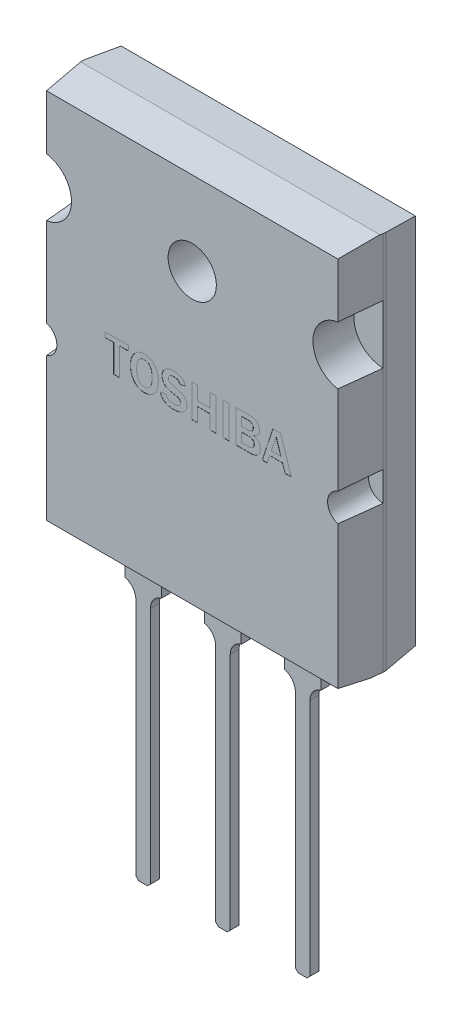
from build123d import *
from OCP.BRepFilletAPI import BRepFilletAPI_MakeChamfer

# Parameters (mm, degrees)
SZKIC1_W                              = 20.5
SZKIC1_H                              = 26
SZKIC1_R                              = 1.65
DODANIE_WYCI_GNI_CIE1_DEPTH           = 5.2
SZKIC2_R                              = 2
SZKIC2_R_2                            = 1
WYTNIJ_WYCI_GNI_CIE1_DEPTH            = 2.8
SZKIC4_W                              = 2.5
SZKIC4_H                              = 0.6
DODANIE_WYCI_GNI_CIE2_DEPTH           = 2.5
SZKIC7_W                              = 1
SZKIC7_H                              = 0.6
DODANIE_WYCI_GNI_CIE3_DEPTH           = 17.5
ZAOKR_GLENIE2_R                       = 1
SFAZOWANIE1_SIZE                      = 0.2
SZYK_LINIOWY2_COUNT                   = 2
SZYK_LINIOWY2_PITCH                   = 5.45
ZAOKR_GLENIE2_OF_SZYK_LINIOWY2_R      = 1
SFAZOWANIE1_OF_SZYK_LINIOWY2_SIZE     = 0.2
SZYK_LINIOWY2_COL_COUNT               = 2
SZYK_LINIOWY2_COL_PITCH               = 5.45
ZAOKR_GLENIE2_OF_SZYK_LINIOWY2_COL_R  = 1
SFAZOWANIE1_OF_SZYK_LINIOWY2_COL_SIZE = 0.2
SFAZOWANIE3_SIZE                      = 2.2
SFAZOWANIE3_SIZE2                     = 0.19247506
SFAZOWANIE4_SIZE                      = 2.8
SFAZOWANIE4_SIZE2                     = 0.294291859
SFAZOWANIE5_SIZE                      = 0.294291859
SFAZOWANIE5_SIZE_2                    = 2.8
SFAZOWANIE6_SIZE                      = 2.2
SFAZOWANIE6_SIZE2                     = 0.270126034
SFAZOWANIE7_SIZE                      = 2
SFAZOWANIE7_SIZE2                     = 0.281081669
SZKIC8_W                              = 0.401396687
SZKIC8_H                              = 2.223120117
WYTNIJ_WYCI_GNI_CIE2_DEPTH            = 0.01


with BuildPart() as part:
    # Szkic1 → Dodanie-wyciągnięcie1 (new body)
    with BuildSketch(Plane.XY):
        with Locations((-13.182644045, 6.74550931)):
            Rectangle(SZKIC1_W, SZKIC1_H)
        with Locations((-13.182644045, 13.74550931)):
            Circle(SZKIC1_R, mode=Mode.SUBTRACT)
    extrude(amount=DODANIE_WYCI_GNI_CIE1_DEPTH)

    # Szkic2 → Wytnij-wyciągnięcie1 (cut)
    with BuildSketch(Plane.XY.offset(5.2)):
        with Locations((-23.432644045, 13.74550931)):
            Circle(SZKIC2_R)
        with Locations((-2.932644045, 13.74550931)):
            Circle(SZKIC2_R)
        with Locations((-23.432644045, 4.74550931)):
            Circle(SZKIC2_R_2)
        with Locations((-2.932644045, 4.74550931)):
            Circle(SZKIC2_R_2)
    extrude(amount=-WYTNIJ_WYCI_GNI_CIE1_DEPTH, mode=Mode.SUBTRACT)

    # Szkic4 → Dodanie-wyciągnięcie2 (add)
    with BuildSketch(Plane.XZ.offset(6.25449069)):
        with Locations((-13.183317029, 2.8)):
            Rectangle(SZKIC4_W, SZKIC4_H)
    dodanie_wyci_gni_cie2 = extrude(amount=DODANIE_WYCI_GNI_CIE2_DEPTH)

    # Szkic7 → Dodanie-wyciągnięcie3 (add)
    with BuildSketch(Plane.XZ.offset(8.75449069)):
        with Locations((-13.183317029, 2.8)):
            Rectangle(SZKIC7_W, SZKIC7_H)
    dodanie_wyci_gni_cie3 = extrude(amount=DODANIE_WYCI_GNI_CIE3_DEPTH)

    # Zaokrąglenie2
    # the kernel refuses this fillet: 1 mm, written as the material it adds along each edge
    with BuildSketch(Plane(origin=(-13.683317029, -8.75449069, 2.5), x_dir=(-1, 0, 0), z_dir=(0, 0, 1)), Plane(origin=(-12.683317029, -8.75449069, 3.1), x_dir=(1, 0, 0), z_dir=(0, 0, -1))) as zaokr_glenie2_piece_1:
        with BuildLine():
            CenterArc((1, 0.968245837), ZAOKR_GLENIE2_R, 180, 75.522487814)
            Line((0, 0.968245837), (-0.02, 0.968245837))
            Line((-0.02, 0.968245837), (-0.02, 0))
            Line((-0.02, 0), (0, -0.02))
            ThreePointArc((0, -0.02), (0.375, -0.02), (0.745, -0.019364917))
            Line((0.745, -0.019364917), (0.75, 0))
        make_face()
    extrude(amount=0.6)

    # Sfazowanie1
    sfazowanie1_edges = [part.edges().sort_by_distance(p)[0] for p in [
        (-12.683317029, -26.25449069, 2.8),
        (-13.683317029, -26.25449069, 2.8),
    ]]
    chamfer(sfazowanie1_edges, length=SFAZOWANIE1_SIZE)

    # Szyk liniowy2: Dodanie-wyciągnięcie2, Dodanie-wyciągnięcie3 ×2
    with Locations(*[(-i * SZYK_LINIOWY2_PITCH, 0, 0) for i in range(1, SZYK_LINIOWY2_COUNT)]):
        add(dodanie_wyci_gni_cie2)
        add(dodanie_wyci_gni_cie3)

    # Zaokrąglenie2 of Szyk liniowy2
    # the kernel refuses this fillet: 1 mm, written as the material it adds along each edge
    with BuildSketch(Plane(origin=(-19.133317029, -8.75449069, 2.5), x_dir=(-1, 0, 0), z_dir=(0, 0, 1)), Plane(origin=(-18.133317029, -8.75449069, 3.1), x_dir=(1, 0, 0), z_dir=(0, 0, -1))) as zaokr_glenie2_of_szyk_liniowy2_piece_1:
        with BuildLine():
            CenterArc((1, 0.968245837), ZAOKR_GLENIE2_OF_SZYK_LINIOWY2_R, 180, 75.522487814)
            Line((0, 0.968245837), (-0.02, 0.968245837))
            Line((-0.02, 0.968245837), (-0.02, 0))
            Line((-0.02, 0), (0, -0.02))
            ThreePointArc((0, -0.02), (0.375, -0.02), (0.745, -0.019364917))
            Line((0.745, -0.019364917), (0.75, 0))
        make_face()
    extrude(amount=0.6)

    # Sfazowanie1 of Szyk liniowy2
    sfazowanie1_of_szyk_liniowy2_edges = [part.edges().sort_by_distance(p)[0] for p in [
        (-18.133317029, -26.25449069, 2.8),
        (-19.133317029, -26.25449069, 2.8),
    ]]
    chamfer(sfazowanie1_of_szyk_liniowy2_edges, length=SFAZOWANIE1_OF_SZYK_LINIOWY2_SIZE)

    # Szyk liniowy2 col: Dodanie-wyciągnięcie2, Dodanie-wyciągnięcie3 ×2
    with Locations(*[(i * SZYK_LINIOWY2_COL_PITCH, 0, 0) for i in range(1, SZYK_LINIOWY2_COL_COUNT)]):
        add(dodanie_wyci_gni_cie2)
        add(dodanie_wyci_gni_cie3)

    # Zaokrąglenie2 of Szyk liniowy2 col
    # the kernel refuses this fillet: 1 mm, written as the material it adds along each edge
    with BuildSketch(Plane(origin=(-8.233317029, -8.75449069, 2.5), x_dir=(-1, 0, 0), z_dir=(0, 0, 1)), Plane(origin=(-7.233317029, -8.75449069, 3.1), x_dir=(1, 0, 0), z_dir=(0, 0, -1))) as zaokr_glenie2_of_szyk_liniowy2_col_piece_1:
        with BuildLine():
            CenterArc((1, 0.968245837), ZAOKR_GLENIE2_OF_SZYK_LINIOWY2_COL_R, 180, 75.522487814)
            Line((0, 0.968245837), (-0.02, 0.968245837))
            Line((-0.02, 0.968245837), (-0.02, 0))
            Line((-0.02, 0), (0, -0.02))
            ThreePointArc((0, -0.02), (0.375, -0.02), (0.745, -0.019364917))
            Line((0.745, -0.019364917), (0.75, 0))
        make_face()
    extrude(amount=0.6)

    # Sfazowanie1 of Szyk liniowy2 col
    sfazowanie1_of_szyk_liniowy2_col_edges = [part.edges().sort_by_distance(p)[0] for p in [
        (-7.233317029, -26.25449069, 2.8),
        (-8.233317029, -26.25449069, 2.8),
    ]]
    chamfer(sfazowanie1_of_szyk_liniowy2_col_edges, length=SFAZOWANIE1_OF_SZYK_LINIOWY2_COL_SIZE)

    # Sfazowanie3: one chamfer whose edges measure the first distance from different faces: ONE call of the kernel's chamfer builder (chamfer() names one face for all edges)
    sfazowanie3_edges_1 = [part.edges().sort_by_distance(p)[0] for p in [
        (-2.932644045, 6.74550931, 0),
    ]]
    sfazowanie3_side_1 = [part.faces().sort_by_distance(p)[0] for p in [
        (-2.932644045, 6.177941742, 2.42972973),
    ]]
    sfazowanie3_edges_2 = [part.edges().sort_by_distance(p)[0] for p in [
        (-23.432644045, 6.74550931, 0),
    ]]
    sfazowanie3_side_2 = [part.faces().sort_by_distance(p)[0] for p in [
        (-23.432644045, 6.177941742, 2.42972973),
    ]]
    sfazowanie3 = BRepFilletAPI_MakeChamfer(part.part.solid().wrapped)
    for e in sfazowanie3_edges_1:
        sfazowanie3.Add(SFAZOWANIE3_SIZE, SFAZOWANIE3_SIZE2, e.wrapped, sfazowanie3_side_1[0].wrapped)  # the first distance lies on this face
    for e in sfazowanie3_edges_2:
        sfazowanie3.Add(SFAZOWANIE3_SIZE, SFAZOWANIE3_SIZE2, e.wrapped, sfazowanie3_side_2[0].wrapped)  # the first distance lies on this face
    add(Compound.cast(sfazowanie3.Shape()), mode=Mode.REPLACE)

    # Sfazowanie4: one chamfer whose edges measure the first distance from different faces: ONE call of the kernel's chamfer builder (chamfer() names one face for all edges)
    sfazowanie4_edges_1 = [part.edges().sort_by_distance(p)[0] for p in [
        (-2.932644045, -1.25449069, 5.2),
        (-2.932644045, 8.74550931, 5.2),
        (-2.932644045, 17.74550931, 5.2),
    ]]
    sfazowanie4_side_1 = [part.faces().sort_by_distance(p)[0] for p in [
        (-2.932644045, -5.992765643, 3.7),
    ]]
    sfazowanie4_edges_2 = [part.edges().sort_by_distance(p)[0] for p in [
        (-23.432644045, 17.74550931, 5.2),
        (-23.432644045, -1.25449069, 5.2),
        (-23.432644045, 8.74550931, 5.2),
    ]]
    sfazowanie4_side_2 = [part.faces().sort_by_distance(p)[0] for p in [
        (-23.432644045, 19.483784263, 3.7),
    ]]
    sfazowanie4 = BRepFilletAPI_MakeChamfer(part.part.solid().wrapped)
    for e in sfazowanie4_edges_1:
        sfazowanie4.Add(SFAZOWANIE4_SIZE, SFAZOWANIE4_SIZE2, e.wrapped, sfazowanie4_side_1[0].wrapped)  # the first distance lies on this face
    for e in sfazowanie4_edges_2:
        sfazowanie4.Add(SFAZOWANIE4_SIZE, SFAZOWANIE4_SIZE2, e.wrapped, sfazowanie4_side_2[0].wrapped)  # the first distance lies on this face
    add(Compound.cast(sfazowanie4.Shape()), mode=Mode.REPLACE)

    # Sfazowanie5
    # the kernel refuses this chamfer: 2.8, 0.294291859 mm, written as the material it takes off along each edge
    with BuildSketch(Plane(origin=(-30.518693961, 19.74550931, 0), x_dir=(0, -0.9396808679591201, -0.3420524322258136), z_dir=(1, 0, 0))) as sfazowanie5_piece_1:
        Polygon((SFAZOWANIE5_SIZE * 0.939680867141, -SFAZOWANIE5_SIZE * 0.342052431928), (-SFAZOWANIE5_SIZE_2 * 0.342052432226, -SFAZOWANIE5_SIZE_2 * 0.939680867959), (0, 0), align=None)
    extrude(amount=34.672099833, mode=Mode.SUBTRACT)
    with BuildSketch(Plane(origin=(-30.416877162, 19.74550931, 5.2), x_dir=(0, -0.9396808679591199, 0.34205243222581383), z_dir=(1, 0, 0))) as sfazowanie5_piece_2:
        Polygon((SFAZOWANIE5_SIZE * 0.939680867141, SFAZOWANIE5_SIZE * 0.342052431928), (-SFAZOWANIE5_SIZE_2 * 0.342052432226, SFAZOWANIE5_SIZE_2 * 0.939680867959), (0, 0), align=None)
    extrude(amount=34.468466235, mode=Mode.SUBTRACT)

    # Sfazowanie6
    sfazowanie6_edges = [part.edges().sort_by_distance(p)[0] for p in [
        (-13.182644045, -6.25449069, 0),
    ]]
    sfazowanie6_side = [part.faces().sort_by_distance(p)[0] for p in [
        (-3.144136362, -6.25449069, 2.3),
    ]]
    chamfer(sfazowanie6_edges, length=SFAZOWANIE6_SIZE, length2=SFAZOWANIE6_SIZE2, reference=sfazowanie6_side[0])

    # Sfazowanie7
    sfazowanie7_edges = [part.edges().sort_by_distance(p)[0] for p in [
        (-13.182644045, -6.25449069, 5.2),
    ]]
    sfazowanie7_side = [part.faces().sort_by_distance(p)[0] for p in [
        (-13.182590135, -6.25449069, 3.763782719),
    ]]
    chamfer(sfazowanie7_edges, length=SFAZOWANIE7_SIZE, length2=SFAZOWANIE7_SIZE2, reference=sfazowanie7_side[0])

    # Szkic8 → Wytnij-wyciągnięcie2 (cut)
    # profile 1 of 7: a face of its own
    with BuildSketch(Plane.XY.offset(5.2)):
        Polygon((-18.150298801, 4.960266993), (-18.551695489, 4.960266993), (-18.551695489, 6.843743759), (-19.138352186, 6.843743759), (-19.138352186, 7.18338711), (-17.532765435, 7.18338711), (-17.532765435, 6.843743759), (-18.150298801, 6.843743759), align=None)
    # profile 2 of 7: a face of its own
    with BuildSketch(Plane.XY.offset(5.2)):
        with BuildLine():
            add(Edge.make_bspline(
                [(-16.461248555, 4.929390325), (-16.497654026, 4.930381614), (-16.568714872, 4.93231654), (-16.672040727, 4.948211154), (-16.769490735, 4.973259087), (-16.860140354, 5.010706157), (-16.945407926, 5.056745376), (-17.023530318, 5.114663478), (-17.096018206, 5.182052821), (-17.161110016, 5.259786827), (-17.21889623, 5.345117659), (-17.270419427, 5.435380354), (-17.313488984, 5.530862647), (-17.348046206, 5.631289211), (-17.375684426, 5.73623654), (-17.395448588, 5.846228984), (-17.407090262, 5.961092761), (-17.408528121, 6.039315348), (-17.409258762, 6.079063771)],
                knots=[0, 0, 0, 0, 1.043242931, 2.036334791, 2.990296044, 3.920975987, 4.841273629, 5.761617468, 6.701129456, 7.67284199, 8.661396099, 9.652473746, 10.649166003, 11.659658399, 12.694112373, 13.757667053, 14.860569552, 16, 16, 16, 16], degree=3))
            add(Edge.make_bspline(
                [(-17.409258762, 6.079063771), (-17.40837415, 6.118654256), (-17.406640281, 6.196252901), (-17.394518475, 6.310187324), (-17.373946311, 6.419183989), (-17.34422444, 6.523144401), (-17.307263631, 6.622432505), (-17.261688303, 6.716691225), (-17.207305983, 6.805677648), (-17.145573292, 6.889232857), (-17.077007673, 6.965326269), (-17.002315513, 7.032134847), (-16.921838054, 7.088235794), (-16.836294449, 7.134575014), (-16.745399945, 7.170406613), (-16.649288464, 7.196075782), (-16.547758913, 7.211112816), (-16.478345228, 7.213198974), (-16.442915534, 7.214263778)],
                knots=[0, 0, 0, 0, 1.138005514, 2.230528023, 3.28951566, 4.322679413, 5.335030664, 6.331615986, 7.327428993, 8.328774427, 9.313939261, 10.266815759, 11.203027922, 12.127628645, 13.057346614, 14.004915194, 14.981681401, 16, 16, 16, 16], degree=3))
            add(Edge.make_bspline(
                [(-16.442915534, 7.214263778), (-16.407327141, 7.213191365), (-16.337597513, 7.211090146), (-16.23587087, 7.19620304), (-16.139954614, 7.170367601), (-16.049739067, 7.134780865), (-15.965480197, 7.088318379), (-15.886870194, 7.032054025), (-15.814089134, 6.96540305), (-15.747982472, 6.889113524), (-15.688398404, 6.80556115), (-15.63679697, 6.715871163), (-15.59260874, 6.621548489), (-15.556857605, 6.521848927), (-15.528847533, 6.417126773), (-15.509422594, 6.307192964), (-15.496857522, 6.192409826), (-15.495564753, 6.114155732), (-15.494905327, 6.074239291)],
                knots=[0, 0, 0, 0, 1.02633709, 2.010939425, 2.957178878, 3.885676847, 4.801130746, 5.725308908, 6.667572524, 7.640602601, 8.631640706, 9.622917575, 10.621029128, 11.631937575, 12.673784577, 13.743718798, 14.849098988, 16, 16, 16, 16], degree=3))
            add(Edge.make_bspline(
                [(-15.494905327, 6.074239291), (-15.495785369, 6.032399788), (-15.497501852, 5.950793597), (-15.509533449, 5.831382748), (-15.530295129, 5.718146255), (-15.559026929, 5.610885845), (-15.596263682, 5.509665185), (-15.642333204, 5.415014863), (-15.695930429, 5.325969811), (-15.758046093, 5.244288648), (-15.826812238, 5.170638798), (-15.901069058, 5.10573847), (-15.980857954, 5.050768385), (-16.066867913, 5.006760708), (-16.15768188, 4.971749142), (-16.254212568, 4.947328293), (-16.355895712, 4.931874397), (-16.425650871, 4.930229668), (-16.461248555, 4.929390325)],
                knots=[0, 0, 0, 0, 1.192043689, 2.325031033, 3.415180851, 4.468890454, 5.485163586, 6.483175456, 7.463881689, 8.44170429, 9.401288739, 10.330189103, 11.246528187, 12.154384972, 13.076821252, 14.013677384, 14.986333232, 16, 16, 16, 16], degree=3))
        make_face()
        with BuildLine():
            add(Edge.make_bspline(
                [(-16.456906524, 5.269033676), (-16.438700323, 5.269597357), (-16.402904033, 5.270705645), (-16.350364454, 5.279255911), (-16.299753618, 5.292570331), (-16.251592262, 5.312205988), (-16.204955038, 5.336305786), (-16.16135824, 5.367036127), (-16.119413932, 5.40259367), (-16.079428008, 5.443709796), (-16.042755241, 5.492404433), (-16.011425119, 5.549951574), (-15.985561253, 5.616552102), (-15.964172734, 5.691684078), (-15.947395743, 5.775743926), (-15.935680988, 5.868442114), (-15.928404124, 5.970074916), (-15.927598477, 6.040776392), (-15.927178684, 6.077616427)],
                knots=[0, 0, 0, 0, 0.799371324, 1.571691237, 2.33252148, 3.093351724, 3.851718398, 4.633574477, 5.430444829, 6.264760325, 7.147776758, 8.099444007, 9.133127046, 10.280064443, 11.526918667, 12.894681194, 14.381928343, 16, 16, 16, 16], degree=3))
            add(Edge.make_bspline(
                [(-15.927178684, 6.077616427), (-15.927544138, 6.107857831), (-15.928256315, 6.166790554), (-15.933914382, 6.252659077), (-15.944108292, 6.333491171), (-15.95787957, 6.409265389), (-15.975790576, 6.480015503), (-15.997171545, 6.545867866), (-16.023462163, 6.606444994), (-16.053155569, 6.662014858), (-16.086851096, 6.712318492), (-16.125438571, 6.755856382), (-16.168614431, 6.792748794), (-16.216084633, 6.822744752), (-16.268077742, 6.846137638), (-16.32428904, 6.863136448), (-16.385180701, 6.872659827), (-16.427123099, 6.87395433), (-16.448704909, 6.874620427)],
                knots=[0, 0, 0, 0, 1.349221372, 2.629285592, 3.836961412, 4.98250601, 6.063184421, 7.091026383, 8.068024352, 9.005437678, 9.89898793, 10.762982643, 11.592597547, 12.424660018, 13.259563776, 14.128934283, 15.037227567, 16, 16, 16, 16], degree=3))
            add(Edge.make_bspline(
                [(-16.448704909, 6.874620427), (-16.470122473, 6.873918417), (-16.51171342, 6.872555178), (-16.572063578, 6.863550593), (-16.628081024, 6.847423265), (-16.680090204, 6.825280525), (-16.727907088, 6.796430059), (-16.771616893, 6.761319686), (-16.811488128, 6.720213467), (-16.846252769, 6.672154068), (-16.877304106, 6.618158494), (-16.904112419, 6.55780733), (-16.926759768, 6.491067999), (-16.9454024, 6.418329337), (-16.959874808, 6.339175396), (-16.969587175, 6.253743834), (-16.976118551, 6.161985561), (-16.976690353, 6.098695596), (-16.976985406, 6.066037676)],
                knots=[0, 0, 0, 0, 0.939796333, 1.824998347, 2.669230575, 3.491078229, 4.298254311, 5.111545101, 5.944944068, 6.80304059, 7.707165261, 8.673682073, 9.695711643, 10.796188878, 11.965695931, 13.223433485, 14.567278583, 16, 16, 16, 16], degree=3))
            add(Edge.make_bspline(
                [(-16.976985406, 6.066037676), (-16.976672853, 6.034346029), (-16.976066125, 5.972825951), (-16.969750807, 5.883595394), (-16.959283407, 5.800123503), (-16.944378459, 5.72262754), (-16.925867591, 5.650885363), (-16.902570873, 5.585195173), (-16.875226967, 5.525395627), (-16.843951869, 5.471265949), (-16.808051696, 5.423870935), (-16.768834623, 5.38245749), (-16.726011322, 5.347232762), (-16.679261174, 5.318502468), (-16.628736522, 5.296310125), (-16.574658255, 5.28015137), (-16.516870321, 5.27113795), (-16.477199292, 5.269745798), (-16.456906524, 5.269033676)],
                knots=[0, 0, 0, 0, 1.41748779, 2.751638642, 3.999067725, 5.17855805, 6.279598804, 7.310334916, 8.292109387, 9.21746807, 10.100882045, 10.945543608, 11.763498334, 12.574112435, 13.392193692, 14.225256955, 15.09217254, 16, 16, 16, 16], degree=3))
        make_face(mode=Mode.SUBTRACT)
    # profile 3 of 7: a face of its own
    with BuildSketch(Plane.XY.offset(5.2)):
        with BuildLine():
            Line((-15.371398654, 5.516047022), (-14.970001966, 5.577800359))
            add(Edge.make_bspline(
                [(-14.970001966, 5.577800359), (-14.966871627, 5.565345633), (-14.960674746, 5.540690013), (-14.947223416, 5.505488044), (-14.929939145, 5.472922113), (-14.910427075, 5.442435336), (-14.887238202, 5.414632421), (-14.861367087, 5.388849256), (-14.831423872, 5.366400183), (-14.799296984, 5.345360965), (-14.763472625, 5.327698441), (-14.724981525, 5.31144736), (-14.682907256, 5.299044729), (-14.638168311, 5.287335513), (-14.589968348, 5.279795049), (-14.538854824, 5.273129262), (-14.484533336, 5.270096547), (-14.447351865, 5.269394863), (-14.428212927, 5.269033676)],
                knots=[0, 0, 0, 0, 0.906503278, 1.794531689, 2.653089968, 3.506826542, 4.345931772, 5.205316058, 6.079951374, 6.984174854, 7.913723739, 8.896628815, 9.931261938, 11.008351852, 12.160441426, 13.373403739, 14.647975418, 16, 16, 16, 16], degree=3))
            add(Edge.make_bspline(
                [(-14.428212927, 5.269033676), (-14.410841909, 5.269392931), (-14.377032681, 5.270092149), (-14.327854795, 5.273148576), (-14.281800685, 5.279571373), (-14.238887268, 5.28807434), (-14.199043381, 5.299201132), (-14.162233602, 5.312696448), (-14.128368347, 5.328476544), (-14.097885042, 5.346870302), (-14.070816903, 5.367173912), (-14.047128372, 5.388756187), (-14.027034697, 5.411720717), (-14.010495105, 5.435776247), (-13.997920987, 5.461190183), (-13.988448047, 5.487505833), (-13.983144707, 5.515353459), (-13.982351944, 5.534358913), (-13.981948581, 5.544029003)],
                knots=[0, 0, 0, 0, 1.432177615, 2.787448516, 4.058484624, 5.262136698, 6.391060104, 7.464697323, 8.490544801, 9.465814323, 10.393719672, 11.275603429, 12.1023653, 12.903874907, 13.674536984, 14.433365878, 15.202887078, 16, 16, 16, 16], degree=3))
            add(Edge.make_bspline(
                [(-13.981948581, 5.544029003), (-13.982629161, 5.557912829), (-13.983983152, 5.585534254), (-13.993984713, 5.626182962), (-14.01063271, 5.6650638), (-14.029775743, 5.695884109), (-14.049661616, 5.71911338), (-14.068463593, 5.736068073), (-14.091613556, 5.751154191), (-14.117674089, 5.766572442), (-14.148189253, 5.779601648), (-14.182217916, 5.79211701), (-14.219744461, 5.804419091), (-14.246437844, 5.810853383), (-14.260321044, 5.81419985)],
                knots=[0, 0, 0, 0, 1.17420143, 2.336035824, 3.51895815, 4.742210149, 5.38872132, 6.101837877, 6.875610048, 7.722950918, 8.66114818, 9.677330504, 10.791982119, 12, 12, 12, 12], degree=3))
            Line((-14.260321044, 5.81419985), (-14.689699712, 5.907794751))
            add(Edge.make_bspline(
                [(-14.689699712, 5.907794751), (-14.724244161, 5.917504738), (-14.788913158, 5.935682336), (-14.878060223, 5.967520182), (-14.953026082, 6.001069902), (-15.015360982, 6.038134548), (-15.067495709, 6.080479212), (-15.111904537, 6.130239234), (-15.152436034, 6.186288538), (-15.186168511, 6.249897619), (-15.213486139, 6.318349396), (-15.233162637, 6.390035), (-15.245875987, 6.463927188), (-15.247215448, 6.514018865), (-15.247891981, 6.539319107)],
                knots=[0, 0, 0, 0, 1.397719, 2.61660228, 3.684797178, 4.592780459, 5.434346434, 6.290342683, 7.184032299, 8.123130646, 9.087656142, 10.049879301, 11.015035452, 12, 12, 12, 12], degree=3))
            add(Edge.make_bspline(
                [(-15.247891981, 6.539319107), (-15.247333716, 6.564289968), (-15.246244206, 6.613023081), (-15.235079789, 6.684117107), (-15.218065919, 6.751573123), (-15.193135787, 6.815089138), (-15.161746336, 6.875043531), (-15.122545481, 6.930696099), (-15.077251689, 6.983258759), (-15.024320517, 7.030554839), (-14.966811652, 7.073832866), (-14.904792966, 7.111898667), (-14.838321104, 7.142865009), (-14.768461544, 7.169360919), (-14.694580871, 7.189372669), (-14.616831982, 7.203870068), (-14.535198194, 7.212678854), (-14.479374515, 7.213728268), (-14.450887981, 7.214263778)],
                knots=[0, 0, 0, 0, 1.021434402, 1.993430674, 2.938685902, 3.864133431, 4.779977887, 5.702212006, 6.64478129, 7.614143361, 8.601621776, 9.588397735, 10.586657613, 11.599099927, 12.643588854, 13.715254453, 14.834106185, 16, 16, 16, 16], degree=3))
            add(Edge.make_bspline(
                [(-14.450887981, 7.214263778), (-14.4270718, 7.213948336), (-14.379997374, 7.213324841), (-14.31026001, 7.206683686), (-14.242423971, 7.196722774), (-14.176439021, 7.182806927), (-14.112682725, 7.164328094), (-14.05080211, 7.142106294), (-13.990705381, 7.116104117), (-13.933262562, 7.085755538), (-13.878789313, 7.052539652), (-13.829345828, 7.015046678), (-13.784658596, 6.974742189), (-13.745837148, 6.930295293), (-13.71190358, 6.882789594), (-13.68269366, 6.832076774), (-13.659399374, 6.777548241), (-13.648050304, 6.739498469), (-13.64230523, 6.720237086)],
                knots=[0, 0, 0, 0, 1.121081787, 2.215900238, 3.295344559, 4.348303825, 5.388415463, 6.418334027, 7.442446413, 8.468712031, 9.475233418, 10.442954056, 11.386282393, 12.303758666, 13.215687437, 14.131412202, 15.054091978, 16, 16, 16, 16], degree=3))
            Line((-13.64230523, 6.720237086), (-14.012825249, 6.627607081))
            add(Edge.make_bspline(
                [(-14.012825249, 6.627607081), (-14.020855244, 6.647234499), (-14.03650135, 6.6854777), (-14.070555303, 6.736332981), (-14.111617955, 6.779735922), (-14.160724199, 6.814738338), (-14.217036213, 6.84192483), (-14.280672973, 6.861071134), (-14.351564528, 6.872650523), (-14.401310106, 6.87394531), (-14.427248032, 6.874620427)],
                knots=[0, 0, 0, 0, 0.979860112, 1.90921631, 2.815097304, 3.732655011, 4.685111648, 5.697917389, 6.799667264, 8, 8, 8, 8], degree=3))
            add(Edge.make_bspline(
                [(-14.427248032, 6.874620427), (-14.44253842, 6.874549746), (-14.472208055, 6.874412595), (-14.51531957, 6.870073175), (-14.555908143, 6.86484007), (-14.593530959, 6.855855243), (-14.628471134, 6.845429224), (-14.660665, 6.832545054), (-14.689607183, 6.816275428), (-14.724323688, 6.793329382), (-14.760476325, 6.75932721), (-14.792161834, 6.711958411), (-14.812382948, 6.659063042), (-14.814522313, 6.621677767), (-14.815618625, 6.602519788)],
                knots=[0, 0, 0, 0, 1.035205943, 2.00872485, 2.933153036, 3.805256842, 4.625460782, 5.402338041, 6.148352159, 6.870518024, 8.219192604, 9.476173232, 10.706672071, 12, 12, 12, 12], degree=3))
            add(Edge.make_bspline(
                [(-14.815618625, 6.602519788), (-14.814735658, 6.587437393), (-14.812992887, 6.557668257), (-14.797599905, 6.515050912), (-14.772808016, 6.475983237), (-14.737701635, 6.441211753), (-14.693340985, 6.410180931), (-14.639519216, 6.382798854), (-14.576176738, 6.35890227), (-14.53013665, 6.346565802), (-14.505887046, 6.340068107)],
                knots=[0, 0, 0, 0, 0.822461176, 1.623346932, 2.445431996, 3.334567304, 4.305624712, 5.394996794, 6.627928439, 8, 8, 8, 8], degree=3))
            Line((-14.505887046, 6.340068107), (-14.128130307, 6.246473206))
            add(Edge.make_bspline(
                [(-14.128130307, 6.246473206), (-14.100546449, 6.239211535), (-14.047385684, 6.225216537), (-13.97172806, 6.200151217), (-13.903354966, 6.172154335), (-13.841575817, 6.142515363), (-13.787093466, 6.109784615), (-13.740241125, 6.073786431), (-13.699336939, 6.036323354), (-13.666469166, 5.995078744), (-13.639227004, 5.952413069), (-13.615272287, 5.90910249), (-13.594811947, 5.864692438), (-13.578718863, 5.818863595), (-13.565306822, 5.772234599), (-13.556271361, 5.724431069), (-13.55088941, 5.675539614), (-13.5500819, 5.642622668), (-13.549675225, 5.626045153)],
                knots=[0, 0, 0, 0, 1.473866493, 2.840497168, 4.115292094, 5.289836584, 6.378785917, 7.392749226, 8.339352561, 9.237544684, 10.108921367, 10.953285444, 11.793796016, 12.632373196, 13.461174096, 14.298968425, 15.143332502, 16, 16, 16, 16], degree=3))
            add(Edge.make_bspline(
                [(-13.549675225, 5.626045153), (-13.550377822, 5.599627354), (-13.551747345, 5.548132975), (-13.563575419, 5.472978379), (-13.583234383, 5.40232877), (-13.611112354, 5.335964497), (-13.646460966, 5.273828745), (-13.68981376, 5.216052337), (-13.74093387, 5.162554424), (-13.799769265, 5.114143566), (-13.864940888, 5.071151707), (-13.93442376, 5.032726082), (-14.008958748, 5.000714157), (-14.088209208, 4.975035318), (-14.17178604, 4.953983108), (-14.260090671, 4.939847858), (-14.35292719, 4.930939297), (-14.416452051, 4.929914646), (-14.448958189, 4.929390325)],
                knots=[0, 0, 0, 0, 0.991738228, 1.933126419, 2.849078392, 3.739748375, 4.62976276, 5.527307927, 6.445805432, 7.402435798, 8.382425022, 9.374475877, 10.380911381, 11.423787365, 12.50050144, 13.614615858, 14.779381419, 16, 16, 16, 16], degree=3))
            add(Edge.make_bspline(
                [(-14.448958189, 4.929390325), (-14.476468237, 4.929927472), (-14.53075427, 4.930987435), (-14.611011338, 4.937178608), (-14.68872764, 4.94812182), (-14.763534319, 4.964313862), (-14.836025797, 4.983945975), (-14.905796339, 5.00856593), (-14.973027385, 5.037557441), (-15.0372606, 5.070700899), (-15.097800663, 5.108481777), (-15.152762472, 5.152213956), (-15.203062975, 5.200173222), (-15.247706973, 5.253594836), (-15.286541536, 5.312311939), (-15.321295864, 5.375267373), (-15.349791162, 5.443627247), (-15.364110304, 5.49161935), (-15.371398654, 5.516047022)],
                knots=[0, 0, 0, 0, 1.116040048, 2.202300261, 3.263289388, 4.297135836, 5.305305074, 6.308056285, 7.295733137, 8.273209508, 9.23788838, 10.185429691, 11.117437599, 12.052955049, 13.002873909, 13.969205781, 14.966338816, 16, 16, 16, 16], degree=3))
        make_face()
    # profile 4 of 7: a face of its own
    with BuildSketch(Plane.XY.offset(5.2)):
        Polygon((-11.573568454, 4.960266993), (-11.974965142, 4.960266993), (-11.974965142, 5.91744371), (-12.808635186, 5.91744371), (-12.808635186, 4.960266993), (-13.210031874, 4.960266993), (-13.210031874, 7.18338711), (-12.808635186, 7.18338711), (-12.808635186, 6.257087061), (-11.974965142, 6.257087061), (-11.974965142, 7.18338711), (-11.573568454, 7.18338711), align=None)
    # profile 5 of 7: a face of its own
    with BuildSketch(Plane.XY.offset(5.2)):
        with Locations((-10.878843418, 6.071827052)):
            Rectangle(SZKIC8_W, SZKIC8_H)
    # profile 6 of 7: a face of its own
    with BuildSketch(Plane.XY.offset(5.2)):
        with BuildLine():
            Line((-10.184118381, 4.960266993), (-10.184118381, 7.18338711))
            Line((-10.184118381, 7.18338711), (-9.307992918, 7.18338711))
            add(Edge.make_bspline(
                [(-9.307992918, 7.18338711), (-9.27243075, 7.182901411), (-9.204407239, 7.181972362), (-9.107241121, 7.173100704), (-9.019485529, 7.159701308), (-8.940078188, 7.139553653), (-8.866974349, 7.110552947), (-8.800137587, 7.06821919), (-8.738852983, 7.013110905), (-8.693110367, 6.958436242), (-8.660137866, 6.909833332), (-8.638153874, 6.871024619), (-8.620183844, 6.83044516), (-8.604218898, 6.788790737), (-8.592789282, 6.745070607), (-8.584891449, 6.699864162), (-8.579041768, 6.653166235), (-8.578703634, 6.621515023), (-8.57853163, 6.605414475)],
                knots=[0, 0, 0, 0, 1.610813873, 3.081173729, 4.416771403, 5.629086056, 6.78591967, 7.964484454, 9.192786364, 10.506300561, 11.183277634, 11.852049577, 12.523791655, 13.192365121, 13.871026073, 14.567026533, 15.271065618, 16, 16, 16, 16], degree=3))
            add(Edge.make_bspline(
                [(-8.57853163, 6.605414475), (-8.578933794, 6.590282657), (-8.579727767, 6.560408656), (-8.58509213, 6.516317804), (-8.59410413, 6.473776389), (-8.607546433, 6.432940249), (-8.623582562, 6.393279642), (-8.64439646, 6.355504133), (-8.66775517, 6.318689847), (-8.695342802, 6.284031742), (-8.726161966, 6.251891766), (-8.759616875, 6.222219156), (-8.795839308, 6.195538026), (-8.835258261, 6.172422081), (-8.87715164, 6.152094942), (-8.921947957, 6.135271308), (-8.969331262, 6.121118326), (-9.002221644, 6.114356234), (-9.019006601, 6.110905335)],
                knots=[0, 0, 0, 0, 1.004048794, 1.982243831, 2.942994346, 3.884587787, 4.831908918, 5.777304598, 6.742313046, 7.722310994, 8.711101451, 9.693942417, 10.686469052, 11.691254846, 12.72222181, 13.772667478, 14.863324848, 16, 16, 16, 16], degree=3))
            add(Edge.make_bspline(
                [(-9.019006601, 6.110905335), (-8.99901987, 6.107108802), (-8.959908776, 6.099679546), (-8.903274002, 6.08500123), (-8.850717456, 6.065912486), (-8.801508327, 6.04447255), (-8.756521236, 6.01873141), (-8.715237795, 5.989570468), (-8.677404084, 5.957284046), (-8.643733786, 5.92146933), (-8.613828793, 5.883283846), (-8.587507707, 5.843250827), (-8.566068207, 5.801154789), (-8.547738709, 5.757734768), (-8.533991934, 5.712420462), (-8.523639347, 5.665355834), (-8.517899517, 5.616540032), (-8.517154889, 5.583442918), (-8.516778293, 5.566704056)],
                knots=[0, 0, 0, 0, 1.199838619, 2.347907872, 3.445988123, 4.494785203, 5.510106937, 6.496984388, 7.472307218, 8.438501038, 9.391049818, 10.330282233, 11.259353718, 12.173587218, 13.106668858, 14.048054108, 15.012803517, 16, 16, 16, 16], degree=3))
            add(Edge.make_bspline(
                [(-8.516778293, 5.566704056), (-8.517122342, 5.545603104), (-8.517797463, 5.504197091), (-8.5266504, 5.443574691), (-8.53912437, 5.385367079), (-8.558437461, 5.330147247), (-8.582024045, 5.277196747), (-8.611118337, 5.226626988), (-8.646063722, 5.179057887), (-8.685591194, 5.133804977), (-8.730742904, 5.092676399), (-8.782250511, 5.057361291), (-8.838731801, 5.026519732), (-8.901790862, 5.002897757), (-8.96994539, 4.983289827), (-9.044173141, 4.970238571), (-9.123828183, 4.96189301), (-9.178835157, 4.9608197), (-9.207161298, 4.960266993)],
                knots=[0, 0, 0, 0, 0.972590954, 1.908497531, 2.821029175, 3.714913375, 4.601532993, 5.492302228, 6.400480685, 7.320341536, 8.260560732, 9.209317351, 10.195173566, 11.221593632, 12.308945412, 13.462897255, 14.693505127, 16, 16, 16, 16], degree=3))
            Line((-9.207161298, 4.960266993), (-10.184118381, 4.960266993))
        make_face()
        with BuildLine():
            Line((-9.813598361, 6.257087061), (-9.331150419, 6.257087061))
            add(Edge.make_bspline(
                [(-9.331150419, 6.257087061), (-9.307742205, 6.258031965), (-9.262743739, 6.259848387), (-9.198890346, 6.275741695), (-9.143140831, 6.303343544), (-9.095751151, 6.34083674), (-9.058178419, 6.386848256), (-9.030421573, 6.439233029), (-9.013508503, 6.497602707), (-9.01172186, 6.538562217), (-9.010804986, 6.559581921)],
                knots=[0, 0, 0, 0, 1.133267777, 2.178522015, 3.161367536, 4.126535266, 5.084470808, 6.018750761, 6.983257536, 8, 8, 8, 8], degree=3))
            add(Edge.make_bspline(
                [(-9.010804986, 6.559581921), (-9.011029528, 6.571339211), (-9.011468345, 6.594316187), (-9.016407119, 6.62745765), (-9.024123639, 6.658179549), (-9.034608466, 6.686551195), (-9.048957962, 6.712279401), (-9.065643972, 6.736020558), (-9.085794663, 6.757177249), (-9.116922987, 6.781169939), (-9.159446281, 6.806660718), (-9.215666228, 6.827958054), (-9.275837709, 6.841414759), (-9.317569119, 6.842956716), (-9.338869586, 6.843743759)],
                knots=[0, 0, 0, 0, 0.863104079, 1.686742686, 2.454611874, 3.187421923, 3.901129515, 4.612486802, 5.314364167, 6.037589576, 7.494279435, 8.937832905, 10.437014525, 12, 12, 12, 12], degree=3))
            Line((-9.338869586, 6.843743759), (-9.813598361, 6.843743759))
            Line((-9.813598361, 6.843743759), (-9.813598361, 6.257087061))
        make_face(mode=Mode.SUBTRACT)
        with BuildLine():
            Line((-9.813598361, 5.299910344), (-9.300756199, 5.299910344))
            add(Edge.make_bspline(
                [(-9.300756199, 5.299910344), (-9.27493776, 5.30085513), (-9.225686151, 5.302657416), (-9.155900345, 5.318264135), (-9.094347301, 5.344101839), (-9.042644811, 5.381527769), (-9.000329719, 5.426926231), (-8.970319002, 5.48124823), (-8.951921226, 5.542693529), (-8.950029567, 5.586190628), (-8.949051649, 5.608677027)],
                knots=[0, 0, 0, 0, 1.172003459, 2.23572989, 3.230795107, 4.183948187, 5.114993859, 6.027792754, 6.980441446, 8, 8, 8, 8], degree=3))
            add(Edge.make_bspline(
                [(-8.949051649, 5.608677027), (-8.950005997, 5.630371981), (-8.951866775, 5.672672566), (-8.971017302, 5.732605598), (-9.001698742, 5.786306497), (-9.044157975, 5.832423012), (-9.095856086, 5.871125339), (-9.156963764, 5.89790085), (-9.225374805, 5.914964247), (-9.273628793, 5.916593129), (-9.298826407, 5.91744371)],
                knots=[0, 0, 0, 0, 0.992015124, 1.934220336, 2.852461805, 3.807761588, 4.788476824, 5.791718758, 6.846863822, 8, 8, 8, 8], degree=3))
            Line((-9.298826407, 5.91744371), (-9.813598361, 5.91744371))
            Line((-9.813598361, 5.91744371), (-9.813598361, 5.299910344))
        make_face(mode=Mode.SUBTRACT)
    # profile 7 of 7: a face of its own
    with BuildSketch(Plane.XY.offset(5.2)):
        Polygon((-6.409445682, 4.960266993), (-6.837377007, 4.960266993), (-7.012023162, 5.485170354), (-7.885736385, 5.485170354), (-8.058935196, 4.960266993), (-8.400990787, 4.960266993), (-7.668152363, 7.18338711), (-7.150485721, 7.18338711), align=None)
        Polygon((-7.125880876, 5.824813705), (-7.451533237, 6.802253236), (-7.77429091, 5.824813705), align=None, mode=Mode.SUBTRACT)
    extrude(amount=-WYTNIJ_WYCI_GNI_CIE2_DEPTH, mode=Mode.SUBTRACT)


solid = part.part
